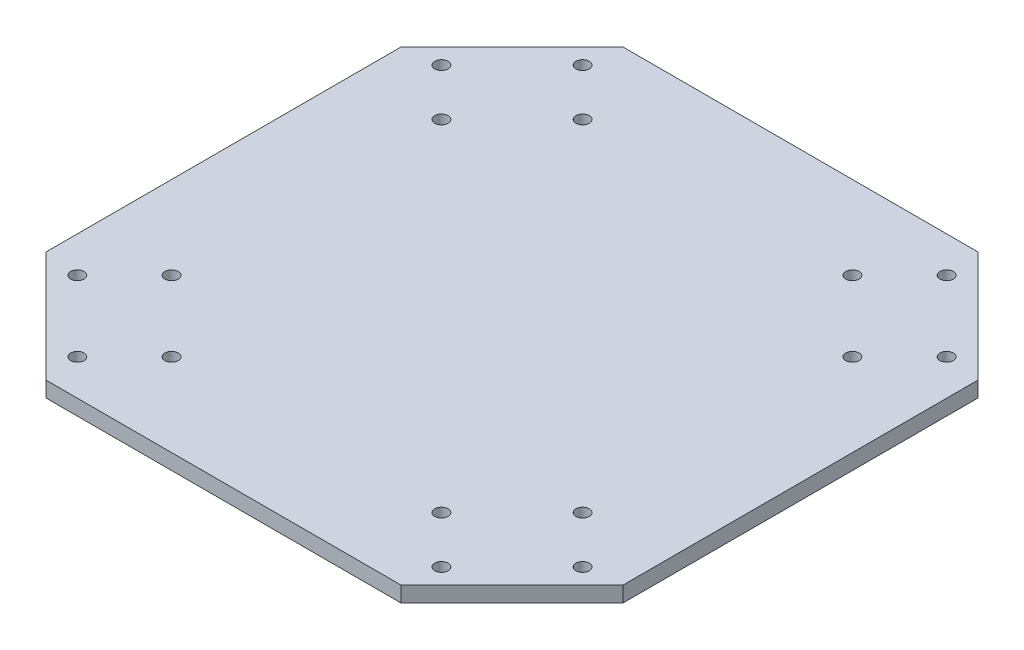
from build123d import *

# Parameters (mm, degrees)
SKETCH2_R           = 1.5
BOSS_EXTRUDE1_DEPTH = 3.5


with BuildPart() as part:
    # Sketch2 → Boss-Extrude1 (new body)
    with BuildSketch(Plane(origin=(0, 0, 0), x_dir=(1, 0, 0), z_dir=(0, 1, 0))):
        Polygon((-65, 40), (-40, 65), (40, 65), (65, 40), (65, -40), (40, -65), (-40, -65), (-65, -40), align=None)
        with Locations((-56.919417382, -41.009514806)):
            Circle(SKETCH2_R, mode=Mode.SUBTRACT)
        with Locations((-41.009514806, -56.919417382)):
            Circle(SKETCH2_R, mode=Mode.SUBTRACT)
        with Locations((-30.402913088, -46.312815665)):
            Circle(SKETCH2_R, mode=Mode.SUBTRACT)
        with Locations((-46.312815665, -30.402913088)):
            Circle(SKETCH2_R, mode=Mode.SUBTRACT)
        with Locations((46.312815665, 30.402913088)):
            Circle(SKETCH2_R, mode=Mode.SUBTRACT)
        with Locations((56.919417382, 41.009514806)):
            Circle(SKETCH2_R, mode=Mode.SUBTRACT)
        with Locations((41.009514806, 56.919417382)):
            Circle(SKETCH2_R, mode=Mode.SUBTRACT)
        with Locations((30.402913088, 46.312815665)):
            Circle(SKETCH2_R, mode=Mode.SUBTRACT)
        with Locations((-41.009514806, 56.919417382)):
            Circle(SKETCH2_R, mode=Mode.SUBTRACT)
        with Locations((-30.402913088, 46.312815665)):
            Circle(SKETCH2_R, mode=Mode.SUBTRACT)
        with Locations((-56.919417382, 41.009514806)):
            Circle(SKETCH2_R, mode=Mode.SUBTRACT)
        with Locations((-46.312815665, 30.402913088)):
            Circle(SKETCH2_R, mode=Mode.SUBTRACT)
        with Locations((30.402913088, -46.312815665)):
            Circle(SKETCH2_R, mode=Mode.SUBTRACT)
        with Locations((46.312815665, -30.402913088)):
            Circle(SKETCH2_R, mode=Mode.SUBTRACT)
        with Locations((56.919417382, -41.009514806)):
            Circle(SKETCH2_R, mode=Mode.SUBTRACT)
        with Locations((41.009514806, -56.919417382)):
            Circle(SKETCH2_R, mode=Mode.SUBTRACT)
    extrude(amount=BOSS_EXTRUDE1_DEPTH)


solid = part.part
